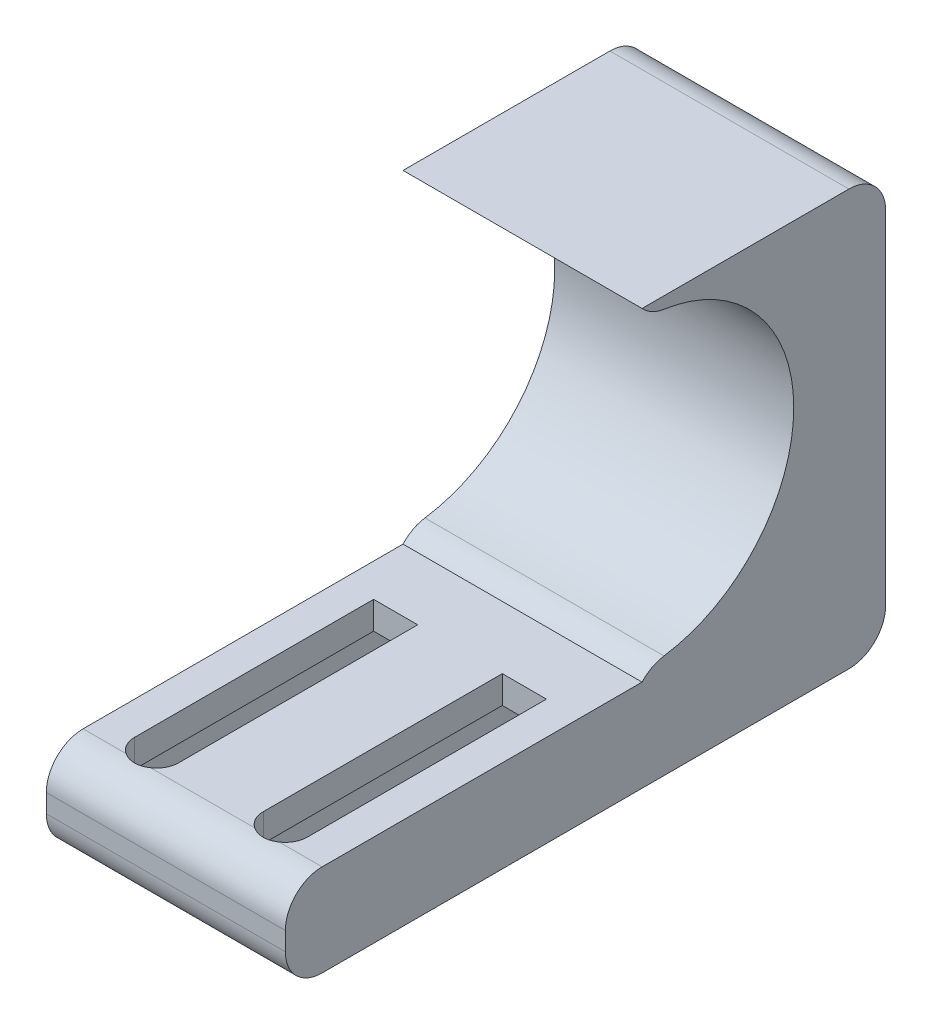
from build123d import *

# Parameters (mm, degrees)
SKETCH1_W               = 13
SKETCH1_H               = 13
BOSS_EXTRUDE1_DEPTH     = 5
SKETCH2_W               = 13
SKETCH2_H               = 5
BOSS_EXTRUDE2_DEPTH     = 16.4
SKETCH3_W               = 13
SKETCH3_H               = 10
BOSS_EXTRUDE3_DEPTH     = 17.6
SKETCH4_R               = 8.25
CUT_EXTRUDE1_DEPTH      = 13
SKETCH5_W               = 13
SKETCH5_H               = 22.6
BOSS_EXTRUDE4_DEPTH     = 3.25
CUT_EXTRUDE2_DEPTH      = 1
CUT_EXTRUDE2_DEPTH_BACK = 1
CUT_EXTRUDE2_START      = -2.5
CUT_EXTRUDE3_REACH      = 37.169
FILLET2_R               = 2


with BuildPart() as part:
    # Sketch1 → Boss-Extrude1 (new body)
    with BuildSketch(Plane(origin=(0, 0, 0), x_dir=(1, 0, 0), z_dir=(0, 1, 0))):
        Rectangle(SKETCH1_W, SKETCH1_H)
    extrude(amount=BOSS_EXTRUDE1_DEPTH)

    # Sketch2 → Boss-Extrude2 (add)
    with BuildSketch(Plane(origin=(0, 0, -6.5), x_dir=(-1, 0, 0), z_dir=(0, 0, -1))):
        with Locations((0, 2.5)):
            Rectangle(SKETCH2_W, SKETCH2_H)
    extrude(amount=BOSS_EXTRUDE2_DEPTH)

    # Sketch3 → Boss-Extrude3 (add)
    with BuildSketch(Plane(origin=(0, 5, 0), x_dir=(1, 0, 0), z_dir=(0, 1, 0))):
        with Locations((0, 17.9)):
            Rectangle(SKETCH3_W, SKETCH3_H)
    extrude(amount=BOSS_EXTRUDE3_DEPTH)

    # Sketch4 → Cut-Extrude1 (cut)
    with BuildSketch(Plane(origin=(6.5, 0, 0), x_dir=(0, 0, -1), z_dir=(1, 0, 0))):
        with Locations((12.9, 13.8)):
            Circle(SKETCH4_R)
    extrude(amount=-CUT_EXTRUDE1_DEPTH, mode=Mode.SUBTRACT)

    # Sketch5 → Boss-Extrude4 (add)
    with BuildSketch(Plane(origin=(0, 0, -22.9), x_dir=(-1, 0, 0), z_dir=(0, 0, -1))):
        with Locations((0, 11.3)):
            Rectangle(SKETCH5_W, SKETCH5_H)
    extrude(amount=BOSS_EXTRUDE4_DEPTH)

    # Sketch6 → Cut-Extrude2 (cut, two sides: drawn at the far end of the back side and taken through both)
    with BuildSketch(Plane.XZ.offset(CUT_EXTRUDE2_START - CUT_EXTRUDE2_DEPTH_BACK)):
        Polygon((5.65, 2.258696921), (5.65, -26.15), (1.35, -26.15), (1.35, 2.258696921), (1.35, 4.741303079), (3.5, 5.982606158), (5.65, 4.741303079), align=None)
        Polygon((-1.35, 2.258696921), (-1.35, 4.741303079), (-3.5, 5.982606158), (-5.65, 4.741303079), (-5.65, 2.258696921), (-5.65, -26.15), (-1.35, -26.15), align=None)
    extrude(amount=CUT_EXTRUDE2_DEPTH + CUT_EXTRUDE2_DEPTH_BACK, mode=Mode.SUBTRACT)

    # Cut-Extrude3: up to this face of the body (flat: up to its plane)
    cut_extrude3_end = Plane(part.part.faces().sort_by_distance((0, 5, -3.2))[0])
    # Sketch7 → Cut-Extrude3 (cut, up to the picked face)
    with BuildSketch(Plane.XZ, mode=Mode.PRIVATE) as cut_extrude3_sk1:
        with BuildLine():
            Line((-2.3, 3.5), (-2.3, -9.5))
            Line((-2.3, -9.5), (-4.7, -9.5))
            Line((-4.7, -9.5), (-4.7, 3.5))
            ThreePointArc((-4.7, 3.5), (-3.5, 4.7), (-2.3, 3.5))
        make_face()
    cut_extrude3_tool1 = split(extrude(cut_extrude3_sk1.sketch, amount=-CUT_EXTRUDE3_REACH, mode=Mode.PRIVATE), bisect_by=cut_extrude3_end, keep=Keep.BOTH, mode=Mode.PRIVATE)
    # Sketch7 → Cut-Extrude3 (cut, up to the picked face)
    with BuildSketch(Plane.XZ, mode=Mode.PRIVATE) as cut_extrude3_sk2:
        with BuildLine():
            Line((2.3, 3.5), (2.3, -9.5))
            Line((2.3, -9.5), (4.7, -9.5))
            Line((4.7, -9.5), (4.7, 3.5))
            ThreePointArc((4.7, 3.5), (3.5, 4.7), (2.3, 3.5))
        make_face()
    cut_extrude3_tool2 = split(extrude(cut_extrude3_sk2.sketch, amount=-CUT_EXTRUDE3_REACH, mode=Mode.PRIVATE), bisect_by=cut_extrude3_end, keep=Keep.BOTH, mode=Mode.PRIVATE)
    add(cut_extrude3_tool1.solids().sort_by(Axis((-3.5, 0, -2.526189), (0, 1, 0)))[0], mode=Mode.SUBTRACT)
    add(cut_extrude3_tool2.solids().sort_by(Axis((3.5, 0, -2.526189), (0, 1, 0)))[0], mode=Mode.SUBTRACT)

    # Fillet2
    # the kernel refuses this fillet: 2 mm, written as the material it takes off along each edge
    with BuildSketch(Plane(origin=(-11.5, 0, 6.5), x_dir=(0, 1, 0), z_dir=(1, 0, 0)), Plane(origin=(-11.5, 0, -26.15), x_dir=(0, 0, 1), z_dir=(1, 0, 0))) as fillet2_piece_1:
        with BuildLine():
            CenterArc((FILLET2_R, -FILLET2_R), FILLET2_R, 90, 90)
            Line((0, -FILLET2_R), (0, 0))
            Line((0, 0), (FILLET2_R, 0))
        make_face()
    extrude(amount=23, mode=Mode.SUBTRACT)
    with BuildSketch(Plane(origin=(-11.5, 5, 6.5), x_dir=(0, -1, 0), z_dir=(1, 0, 0)), Plane(origin=(11.5, 22.6, -26.15), x_dir=(0, -1, 0), z_dir=(-1, 0, 0))) as fillet2_piece_2:
        with BuildLine():
            CenterArc((FILLET2_R, FILLET2_R), FILLET2_R, 180, 90)
            Line((0, FILLET2_R), (0, 0))
            Line((0, 0), (FILLET2_R, 0))
        make_face()
    extrude(amount=23, mode=Mode.SUBTRACT)
    with BuildSketch(Plane(origin=(-9.491448846, 5.55, -12.9), x_dir=(0, 0.0725199720178057, -0.9973669603804493), z_dir=(1, 0, 0))) as fillet2_piece_3:
        with BuildLine():
            CenterArc((1.341619482, -1.994733921), FILLET2_R, 94.15873901, 39.530984807)
            Line((-0.039885985, -0.548551828), (0, 0))
            ThreePointArc((0, 0), (0.598289769, -0.021722577), (1.196579538, 0))
        make_face()
    extrude(amount=18.982897691, mode=Mode.SUBTRACT)
    with BuildSketch(Plane(origin=(-9.491448846, 22.05, -12.9), x_dir=(0, 1, 0), z_dir=(1, 0, 0))) as fillet2_piece_4:
        with BuildLine():
            CenterArc((1.8921875, -1.482744993), FILLET2_R, 132.151537174, 39.530984807)
            ThreePointArc((-0.086775915, -1.193428897), (-0.021722577, -0.598289769), (0, 0))
            Line((0, 0), (0.55, 0))
        make_face()
    extrude(amount=18.982897691, mode=Mode.SUBTRACT)


solid = part.part
